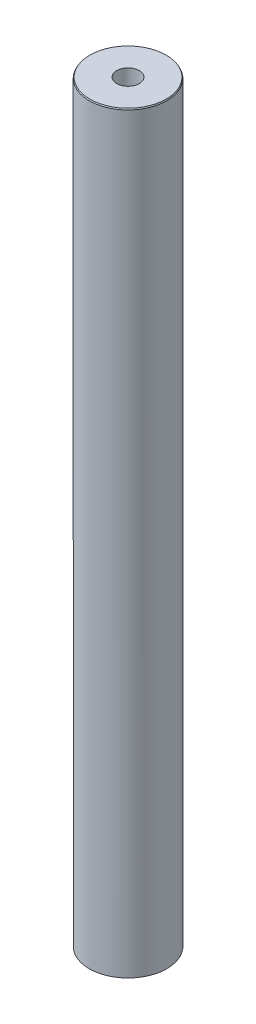
from build123d import *
from OCP.BRepFilletAPI import BRepFilletAPI_MakeChamfer

# Parameters (mm, degrees)
SKETCH1_R           = 7.5
BOSS_EXTRUDE1_DEPTH = 145.748430165
SKETCH2_R           = 2.18043543
CUT_EXTRUDE1_DEPTH  = 147.133859511
CHAMFER1_SIZE       = 0.208465014
CHAMFER1_SIZE2      = 0.120357332


with BuildPart() as part:
    # Sketch1 → Boss-Extrude1 (new body)
    with BuildSketch(Plane(origin=(0, 0, 0), x_dir=(1, 0, 0), z_dir=(0, 1, 0))):
        Circle(SKETCH1_R)
    extrude(amount=BOSS_EXTRUDE1_DEPTH)

    # Sketch2 → Cut-Extrude1 (cut, through all)
    with BuildSketch(Plane(origin=(0, 0, 0), x_dir=(1, 0, 0), z_dir=(0, 1, 0))):
        Circle(SKETCH2_R)
    extrude(amount=CUT_EXTRUDE1_DEPTH, mode=Mode.SUBTRACT)

    # Chamfer1: one chamfer whose edges measure the first distance from different faces: ONE call of the kernel's chamfer builder (chamfer() names one face for all edges)
    chamfer1_edges_1 = [part.edges().sort_by_distance(p)[0] for p in [
        (-7.5, 145.748430165, 0),
    ]]
    chamfer1_side_1 = [part.faces().sort_by_distance(p)[0] for p in [
        (-7.5, 72.874215082, 0),
    ]]
    chamfer1_edges_2 = [part.edges().sort_by_distance(p)[0] for p in [
        (-7.5, 0, 0),
    ]]
    chamfer1_side_2 = [part.faces().sort_by_distance(p)[0] for p in [
        (-7.287867966, 0, 0),
    ]]
    chamfer1 = BRepFilletAPI_MakeChamfer(part.part.solid().wrapped)
    for e in chamfer1_edges_1:
        chamfer1.Add(CHAMFER1_SIZE, CHAMFER1_SIZE2, e.wrapped, chamfer1_side_1[0].wrapped)  # the first distance lies on this face
    for e in chamfer1_edges_2:
        chamfer1.Add(CHAMFER1_SIZE, CHAMFER1_SIZE2, e.wrapped, chamfer1_side_2[0].wrapped)  # the first distance lies on this face
    add(Compound.cast(chamfer1.Shape()), mode=Mode.REPLACE)


solid = part.part
